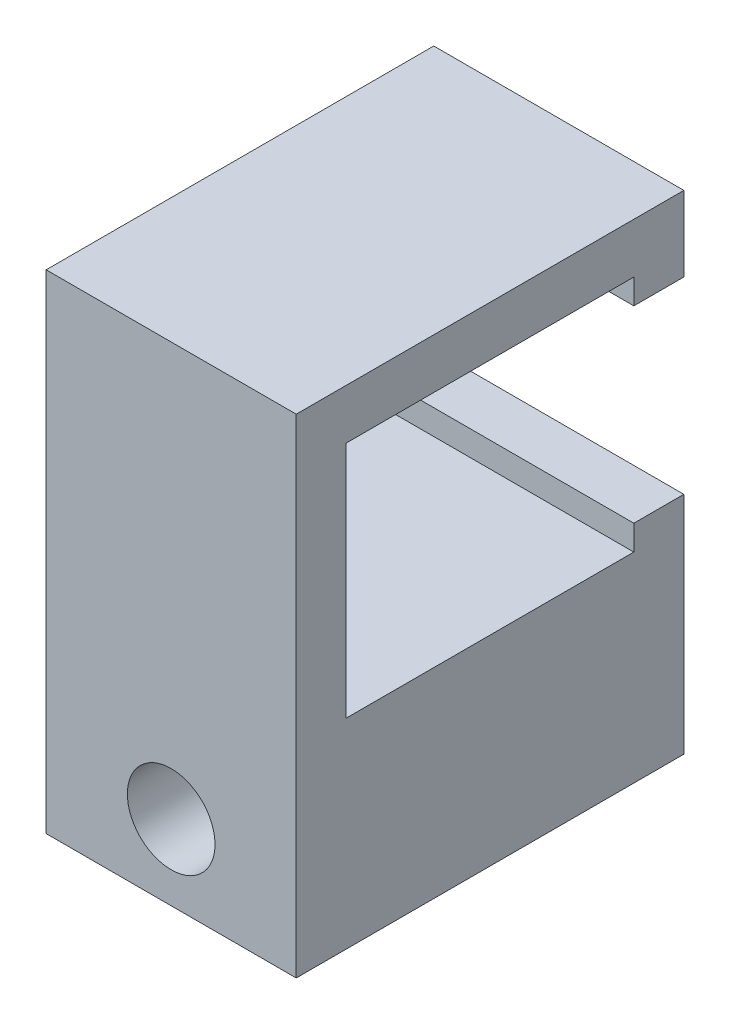
from build123d import *

# Parameters (mm, degrees)
MAINBODY_DEPTH        = 5
SKETCH4_W             = 10
SKETCH4_H             = 15.5
BOSS_EXTRUDE1_DEPTH   = 6
F_6_32_TAPPED_HOLE1_D = 3.5052


with BuildPart() as part:
    # Sketch1 → MainBody (new, symmetric)
    with BuildSketch(Plane(origin=(0, 0, 0), x_dir=(0, 0, -1), z_dir=(1, 0, 0))):
        Polygon((9.494840321, 5.423844791), (-6.005159679, 5.423844791), (-6.005159679, -8.101155209), (9.494840321, -8.101155209), (9.494840321, -5.101155209), (7.494840321, -5.101155209), (7.494840321, -6.101155209), (-4.005159679, -6.101155209), (-4.005159679, 3.423844791), (7.494840321, 3.423844791), (7.494840321, 2.423844791), (9.494840321, 2.423844791), align=None)
    extrude(amount=MAINBODY_DEPTH, both=True)

    # Sketch4 → Boss-Extrude1 (add)
    with BuildSketch(Plane.XZ.offset(8.101155209)):
        with Locations((0, -1.744840321)):
            Rectangle(SKETCH4_W, SKETCH4_H)
    extrude(amount=BOSS_EXTRUDE1_DEPTH)

    # #6-32 Tapped Hole1 (through all)
    with Locations(Plane.XY.offset(6.005159679)):
        with Locations((0, -11.101155209)):
            Hole(F_6_32_TAPPED_HOLE1_D / 2)


solid = part.part
